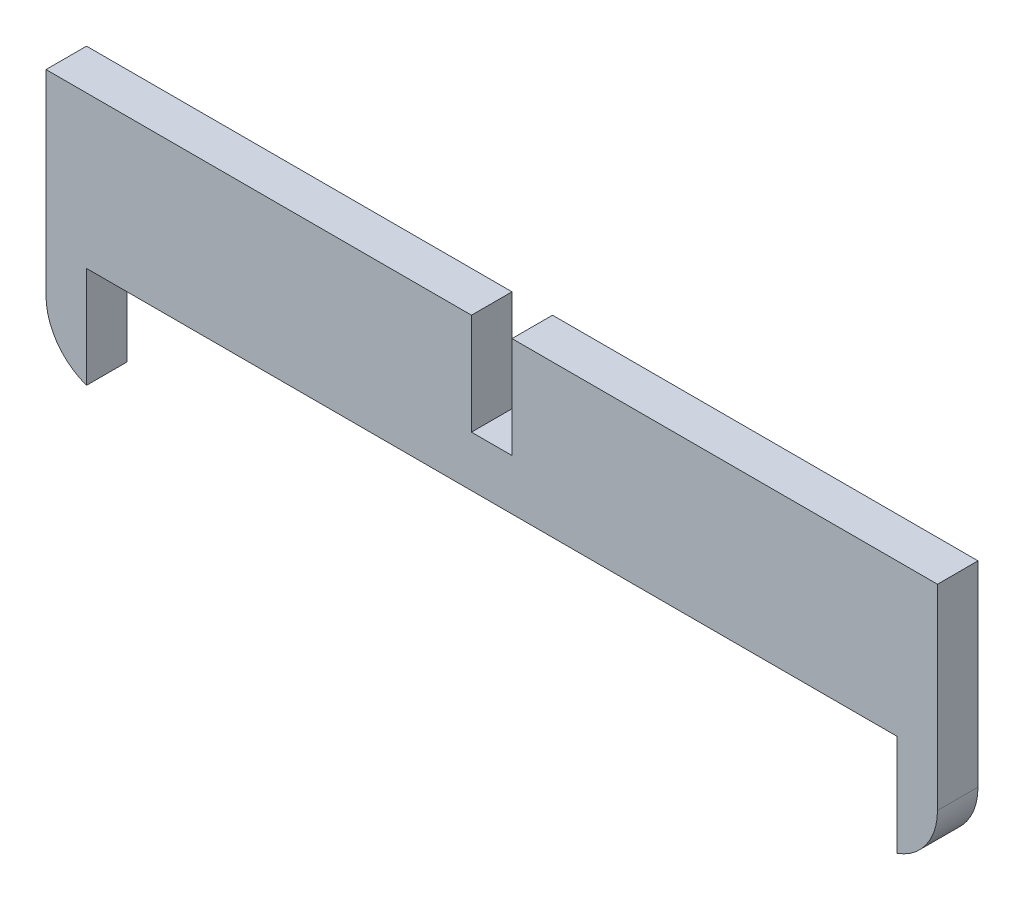
from build123d import *

# Parameters (mm, degrees)
SKETCH1_W           = 111.76
SKETCH1_H           = 19.05
BOSS_EXTRUDE1_DEPTH = 5.08
SKETCH5_W           = 5.08
SKETCH5_H           = 5.08
BOSS_EXTRUDE3_DEPTH = 12.7
FILLET2_R           = 7.62
SKETCH7_W           = 5.08
SKETCH7_H           = 12.7
CUT_EXTRUDE2_DEPTH  = 61.35173092


with BuildPart() as part:
    # Sketch1 → Boss-Extrude1 (new body)
    with BuildSketch(Plane.XY):
        Rectangle(SKETCH1_W, SKETCH1_H)
    extrude(amount=BOSS_EXTRUDE1_DEPTH)

    # Sketch5 → Boss-Extrude3 (add)
    with BuildSketch(Plane.XZ.offset(9.525)):
        with Locations((-53.34, 2.54)):
            Rectangle(SKETCH5_W, SKETCH5_H)
    boss_extrude3 = extrude(amount=BOSS_EXTRUDE3_DEPTH)

    # Mirror1: Boss-Extrude3 across plane
    add(boss_extrude3.mirror(Plane(origin=(0, 0, 0), x_dir=(0, 0, 1), z_dir=(1, 0, 0))))

    # Fillet2
    # the kernel refuses this fillet: 7.62 mm, written as the material it takes off along each edge
    with BuildSketch(Plane(origin=(-55.88, -22.225, -17.960512242), x_dir=(1, 0, 0), z_dir=(0, 0, 1))) as fillet2_piece_1:
        with BuildLine():
            CenterArc((7.62, 7.184204897), FILLET2_R, 180, 70.528779366)
            Line((0, 7.184204897), (-0.1524, 7.184204897))
            Line((-0.1524, 7.184204897), (-0.1524, 0))
            Line((-0.1524, 0), (0, -0.1524))
            ThreePointArc((0, -0.1524), (2.54, -0.1524), (5.0292, -0.143684098))
            Line((5.0292, -0.143684098), (5.08, 0))
        make_face()
    extrude(amount=41.001024484, mode=Mode.SUBTRACT)
    with BuildSketch(Plane(origin=(55.88, -22.225, -17.960512242), x_dir=(0, 1, 0), z_dir=(0, 0, 1))) as fillet2_piece_2:
        with BuildLine():
            CenterArc((7.184204897, 7.62), FILLET2_R, 199.471220634, 70.528779366)
            Line((0, 5.08), (-0.143684098, 5.0292))
            ThreePointArc((-0.143684098, 5.0292), (-0.1524, 2.54), (-0.1524, 0))
            Line((-0.1524, 0), (0, -0.1524))
            Line((0, -0.1524), (7.184204897, -0.1524))
            Line((7.184204897, -0.1524), (7.184204897, 0))
        make_face()
    extrude(amount=41.001024484, mode=Mode.SUBTRACT)

    # Sketch7 → Cut-Extrude2 (cut, through all)
    with BuildSketch(Plane.XY.offset(5.08)):
        with Locations((0, 3.175)):
            Rectangle(SKETCH7_W, SKETCH7_H)
    extrude(amount=-CUT_EXTRUDE2_DEPTH, mode=Mode.SUBTRACT)


solid = part.part
